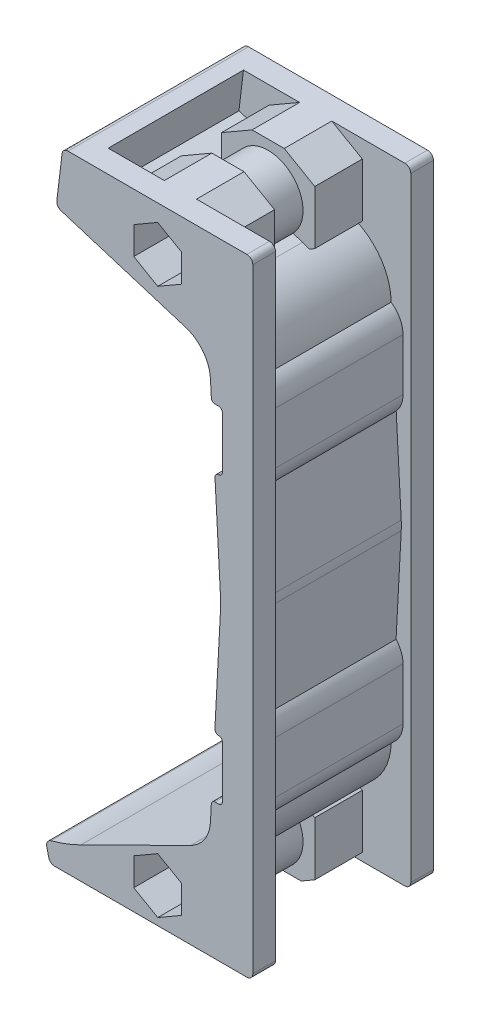
from build123d import *

# Parameters (mm, degrees)
BOSS_EXTRUDE1_DEPTH     = 24.13
CUT_EXTRUDE1_DEPTH      = 139.595056638
CUT_EXTRUDE1_DEPTH_BACK = 139.595056638
FILLET1_R               = 1.5875
CUT_EXTRUDE2_DEPTH      = 12.7
CUT_EXTRUDE3_DEPTH      = 139.595056638
CUT_EXTRUDE3_DEPTH_BACK = 139.595056638
SKETCH4_R               = 3.2639
SHELL1_START            = -18.073116
SHELL1_DEPTH            = 36.146232
SHELL1_START_2          = -5.373116
SHELL1_2_DEPTH          = 10.746232


# Read off the part's stored shape, not the designer's step: Shell1
with BuildPart() as part:
    # Sketch1 → Boss-Extrude1 (new, symmetric)
    with BuildSketch(Plane.XY):
        with BuildLine():
            Line((56.161313585, 65.087564001), (56.15, 65.087371974))
            ThreePointArc((56.15, 65.087371974), (55.438759683, 64.766920639), (55.174115771, 64.033084522))
            Line((55.174115771, 64.033084522), (56.680450554, 36.457041128))
            ThreePointArc((56.680450554, 36.457041128), (56.705496383, 35.550244887), (56.681639728, 34.643416582))
            Line((56.681639728, 34.643416582), (55.144848554, 5.815734008))
            ThreePointArc((55.144848554, 5.815734008), (55.417746823, 5.074471658), (56.143430652, 4.7625))
            Line((56.143430652, 4.7625), (56.149999968, 4.762499984))
            ThreePointArc((56.149999968, 4.762499984), (56.857106771, 4.469606766), (57.15, 3.762499968))
            Line((57.15, 3.762499968), (57.15, -10.112499968))
            ThreePointArc((57.15, -10.112499968), (56.857106771, -10.819606766), (56.149999968, -11.112499984))
            Line((56.149999968, -11.112499984), (55.190522202, -11.1125))
            ThreePointArc((55.190522202, -11.1125), (54.502493828, -11.386816202), (54.191940103, -12.059266056))
            Line((54.191940103, -12.059266056), (53.961494186, -16.382053603))
            ThreePointArc((53.961494186, -16.382053603), (52.407837698, -21.109352316), (48.682296217, -24.408070592))
            Line((48.682296217, -24.408070592), (19.327486058, -38.967689038))
            ThreePointArc((19.327486058, -38.967689038), (0, -43.4975), (-19.327486058, -38.967689038))
            Line((-19.327486058, -38.967689038), (-19.327486058, -47.388950103))
            Line((-19.327486058, -47.388950103), (65.278, -47.388950103))
            Line((65.278, -47.388950103), (65.278, 119.854559949))
            Line((65.278, 119.854559949), (-4.702524006, 119.854559949))
            Line((-4.702524006, 119.854559949), (-4.702524006, 108.02491605))
            ThreePointArc((-4.702524006, 108.02491605), (0, 108.7374), (4.702524006, 108.02491605))
            Line((4.702524006, 108.02491605), (47.271514403, 94.82250963))
            ThreePointArc((47.271514403, 94.82250963), (51.961130003, 91.582350175), (53.960821068, 86.244526329))
            Line((53.960821068, 86.244526329), (54.197705155, 81.907956584))
            ThreePointArc((54.197705155, 81.907956584), (54.508664182, 81.236365226), (55.196216585, 80.9625))
            Line((55.196216585, 80.9625), (56.149999984, 80.962499984))
            ThreePointArc((56.149999984, 80.962499984), (56.857106777, 80.669606761), (57.15, 79.962499968))
            Line((57.15, 79.962499968), (57.15, 66.087500032))
            ThreePointArc((57.15, 66.087500032), (56.8610955, 65.384404568), (56.161313585, 65.087564001))
        make_face()
    extrude(amount=BOSS_EXTRUDE1_DEPTH, both=True)

    # Sketch2 → Cut-Extrude1 (cut, two sides: drawn at the far end of the back side and taken through both)
    with BuildSketch(Plane.XY.offset(-CUT_EXTRUDE1_DEPTH_BACK)):
        Polygon((0, 0), (16.649604997, 137.747881839), (-33.336773011, 132.313158031), (-32.126746787, -67.704176811), (15.765326083, -67.704176811), align=None)
    extrude(amount=CUT_EXTRUDE1_DEPTH + CUT_EXTRUDE1_DEPTH_BACK, mode=Mode.SUBTRACT)

    # Fillet1
    fillet1_edges = [part.edges().sort_by_distance(p)[0] for p in [
        (65.278, 119.854559949, 0),
        (65.278, -47.388950103, 0),
        (11.034802966, -47.388950103, 0),
        (9.864742858, -42.364128158, 0),
        (12.755119811, 105.527472687, 0),
        (14.486836775, 119.854559949, 0),
    ]]
    fillet(fillet1_edges, radius=FILLET1_R)

    # Sketch3 → Cut-Extrude2 (cut)
    with BuildSketch(Plane(origin=(0, 0, -24.13), x_dir=(-1, 0, 0), z_dir=(0, 0, -1))):
        Polygon((-39.878, -30.708992794), (-46.2788, -34.404496397), (-46.2788, -41.795503603), (-39.878, -45.491007206), (-33.4772, -41.795503603), (-33.4772, -34.404496397), align=None)
        Polygon((-33.4772, 111.645503603), (-39.878, 115.341007206), (-46.2788, 111.645503603), (-46.2788, 104.254496397), (-39.878, 100.558992794), (-33.4772, 104.254496397), align=None)
    cut_extrude2 = extrude(amount=-CUT_EXTRUDE2_DEPTH, mode=Mode.SUBTRACT)

    # Mirror1: Cut-Extrude2 across plane
    add(cut_extrude2.mirror(Plane.XY), mode=Mode.SUBTRACT)

    # Sketch4 → Cut-Extrude3 (cut, two sides: drawn at the far end of the back side and taken through both)
    with BuildSketch(Plane.XY.offset(-CUT_EXTRUDE3_DEPTH_BACK)):
        with Locations((39.878, 107.95)):
            Circle(SKETCH4_R)
        with Locations((39.878, -38.1)):
            Circle(SKETCH4_R)
    extrude(amount=CUT_EXTRUDE3_DEPTH + CUT_EXTRUDE3_DEPTH_BACK, mode=Mode.SUBTRACT)

    # Shell1 outline → Shell1 (cut)
    with BuildSketch(Plane.XY.offset(SHELL1_START)):
        Polygon((19.374447508, 109.816041015), (27.420316, 107.32068407), (27.420316, 115.142447211), (35.581934673, 119.854559949), (20.587804641, 119.854559949), align=None)
        with BuildLine():
            Line((52.335684, 100.757552789), (50.881166896, 99.917786948))
            ThreePointArc((50.881166896, 99.917786948), (57.51024809, 94.223530979), (60.031332227, 85.856129752))
            ThreePointArc((60.031332227, 85.856129752), (62.362476281, 83.309849707), (63.206884, 79.962499968))
            Line((63.206884, 79.962499968), (63.206884008, 66.087500032))
            ThreePointArc((63.206884008, 66.087500032), (62.736011515, 63.552926254), (61.386232226, 61.356592716))
            Line((61.386232226, 61.356592716), (62.728318266, 36.787404457))
            ThreePointArc((62.728318266, 36.787404457), (62.762379081, 35.55421632), (62.729935471, 34.320984576))
            Line((62.729935471, 34.320984576), (61.354914269, 8.527841436))
            ThreePointArc((61.354914269, 8.527841436), (62.727616894, 6.318780038), (63.206884, 3.762499968))
            Line((63.206884, 3.762499968), (63.206884, -10.112499968))
            ThreePointArc((63.206884, -10.112499968), (62.362476281, -13.459849707), (60.031332227, -16.006129752))
            ThreePointArc((60.031332227, -16.006129752), (57.656879346, -24.143823794), (51.373585166, -29.834193295))
            Line((51.373585166, -29.834193295), (50.891079569, -30.073510032))
            Line((50.891079569, -30.073510032), (52.335684, -30.907552789))
            Line((52.335684, -30.907552789), (52.335684, -45.292447211))
            Line((52.335684, -45.292447211), (48.704434473, -47.388950103))
            Line((48.704434473, -47.388950103), (63.6905, -47.388950103))
            ThreePointArc((63.6905, -47.388950103), (64.813032015, -46.923982118), (65.278, -45.801450103))
            Line((65.278, -45.801450103), (65.278, 118.267059949))
            ThreePointArc((65.278, 118.267059949), (64.813032015, 119.389591964), (63.6905, 119.854559949))
            Line((63.6905, 119.854559949), (44.174065327, 119.854559949))
            Line((44.174065327, 119.854559949), (52.335684, 115.142447211))
            Line((52.335684, 115.142447211), (52.335684, 100.757552789))
        make_face()
        with BuildLine():
            Line((17.253727402, -47.388950103), (31.051565527, -47.388950103))
            Line((31.051565527, -47.388950103), (27.420316, -45.292447211))
            Line((27.420316, -45.292447211), (27.420316, -41.714715011))
            Line((27.420316, -41.714715011), (22.018775007, -44.39381174))
            ThreePointArc((22.018775007, -44.39381174), (19.565089882, -45.528499114), (17.053178169, -46.527691625))
            Line((17.053178169, -46.527691625), (17.253727402, -47.388950103))
        make_face()
    extrude(amount=SHELL1_DEPTH, mode=Mode.SUBTRACT)

    # Shell1 2 outline → Shell1 2 (cut)
    with BuildSketch(Plane.XY.offset(SHELL1_START_2)):
        with BuildLine():
            Line((31.051565527, -47.388950103), (39.108311519, -47.388950103))
            ThreePointArc((39.108311519, -47.388950103), (33.724832418, -45.101110132), (30.764746274, -40.055919453))
            Line((30.764746274, -40.055919453), (27.420316, -41.714715011))
            Line((27.420316, -41.714715011), (27.420316, -45.292447211))
            Line((27.420316, -45.292447211), (31.051565527, -47.388950103))
        make_face()
        with BuildLine():
            ThreePointArc((30.704014451, 106.302273224), (42.639021135, 116.852459024), (46.509623897, 101.40029933))
            Line((46.509623897, 101.40029933), (49.065696603, 100.607555354))
            ThreePointArc((49.065696603, 100.607555354), (49.984188595, 100.290983166), (50.881166896, 99.917786948))
            Line((50.881166896, 99.917786948), (52.335684, 100.757552789))
            Line((52.335684, 100.757552789), (52.335684, 115.142447211))
            Line((52.335684, 115.142447211), (44.174065327, 119.854559949))
            Line((44.174065327, 119.854559949), (35.581934673, 119.854559949))
            Line((35.581934673, 119.854559949), (27.420316, 115.142447211))
            Line((27.420316, 115.142447211), (27.420316, 107.32068407))
            Line((27.420316, 107.32068407), (30.704014451, 106.302273224))
        make_face()
        with BuildLine():
            Line((40.647688481, -47.388950103), (48.704434473, -47.388950103))
            Line((48.704434473, -47.388950103), (52.335684, -45.292447211))
            Line((52.335684, -45.292447211), (52.335684, -30.907552789))
            Line((52.335684, -30.907552789), (50.891079569, -30.073510032))
            Line((50.891079569, -30.073510032), (46.949876749, -32.028297304))
            ThreePointArc((46.949876749, -32.028297304), (48.501221551, -41.637946362), (40.647688481, -47.388950103))
        make_face()
    extrude(amount=SHELL1_2_DEPTH, mode=Mode.SUBTRACT)


solid = part.part
